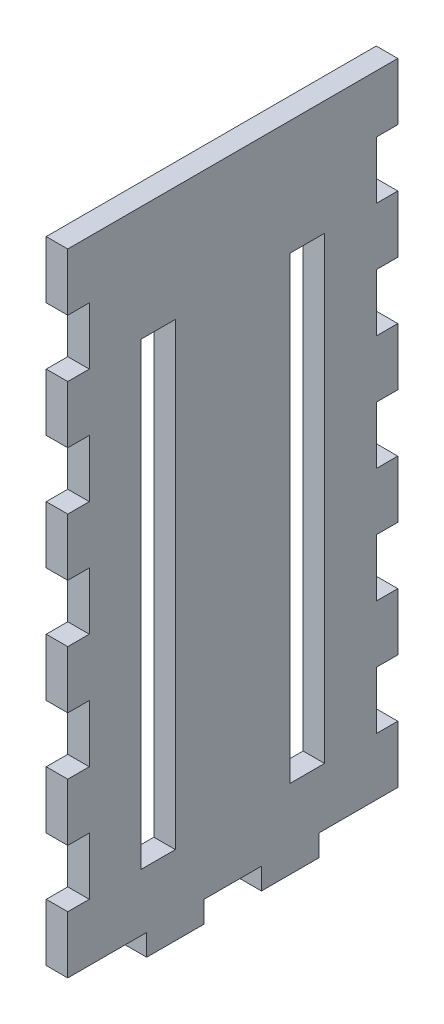
from build123d import *

# Parameters (mm, degrees)
SKETCH1_W               = 127
SKETCH1_H               = 279.4
BOSS_EXTRUDE1_DEPTH     = 9.525
SKETCH2_W               = 9.525
SKETCH2_H               = 25.4
BOSS_EXTRUDE2_DEPTH     = 9.525
LPATTERN1_COUNT         = 6
LPATTERN1_PITCH         = 50.8
MIRROR1_COPY_1_SKETCH_W = 9.525
MIRROR1_COPY_1_SKETCH_H = 25.4
MIRROR1_COPY_1_DEPTH    = 9.525
MIRROR1_COPY_2_SKETCH_W = 9.525
MIRROR1_COPY_2_SKETCH_H = 25.4
MIRROR1_COPY_2_DEPTH    = 9.525
MIRROR1_COPY_3_SKETCH_W = 9.525
MIRROR1_COPY_3_SKETCH_H = 25.4
MIRROR1_COPY_3_DEPTH    = 9.525
MIRROR1_COPY_4_SKETCH_W = 9.525
MIRROR1_COPY_4_SKETCH_H = 25.4
MIRROR1_COPY_4_DEPTH    = 9.525
MIRROR1_COPY_5_SKETCH_W = 9.525
MIRROR1_COPY_5_SKETCH_H = 25.4
MIRROR1_COPY_5_DEPTH    = 9.525
MIRROR1_COPY_6_SKETCH_W = 9.525
MIRROR1_COPY_6_SKETCH_H = 25.4
MIRROR1_COPY_6_DEPTH    = 9.525
SKETCH3_W               = 9.525
SKETCH3_H               = 25.4
BOSS_EXTRUDE3_DEPTH     = 9.525
LPATTERN2_COUNT         = 2
LPATTERN2_PITCH         = 50.8
SKETCH4_W               = 15.24
SKETCH4_H               = 203.2
CUT_EXTRUDE1_DEPTH      = 9.525


with BuildPart() as part:
    # Sketch1 → Boss-Extrude1 (new body)
    with BuildSketch(Plane(origin=(0, 0, 0), x_dir=(0, 0, -1), z_dir=(1, 0, 0))):
        Rectangle(SKETCH1_W, SKETCH1_H)
    extrude(amount=BOSS_EXTRUDE1_DEPTH)

    # Sketch2 → Boss-Extrude2 (add)
    with BuildSketch(Plane.XY.offset(63.5)):
        with Locations((4.7625, 127)):
            Rectangle(SKETCH2_W, SKETCH2_H)
    boss_extrude2 = extrude(amount=BOSS_EXTRUDE2_DEPTH)

    # LPattern1: Boss-Extrude2 ×6
    with Locations(*[(0, -i * LPATTERN1_PITCH, 0) for i in range(1, LPATTERN1_COUNT)]):
        add(boss_extrude2)

    # Mirror1 copy 1 sketch → Mirror1 copy 1 (add)
    with BuildSketch(Plane(origin=(0, -50.8, -63.5), x_dir=(1, 0, 0), z_dir=(0, 0, -1))):
        with Locations((4.7625, -127)):
            Rectangle(MIRROR1_COPY_1_SKETCH_W, MIRROR1_COPY_1_SKETCH_H)
    extrude(amount=MIRROR1_COPY_1_DEPTH)

    # Mirror1 copy 2 sketch → Mirror1 copy 2 (add)
    with BuildSketch(Plane(origin=(0, -101.6, -63.5), x_dir=(1, 0, 0), z_dir=(0, 0, -1))):
        with Locations((4.7625, -127)):
            Rectangle(MIRROR1_COPY_2_SKETCH_W, MIRROR1_COPY_2_SKETCH_H)
    extrude(amount=MIRROR1_COPY_2_DEPTH)

    # Mirror1 copy 3 sketch → Mirror1 copy 3 (add)
    with BuildSketch(Plane(origin=(0, -152.4, -63.5), x_dir=(1, 0, 0), z_dir=(0, 0, -1))):
        with Locations((4.7625, -127)):
            Rectangle(MIRROR1_COPY_3_SKETCH_W, MIRROR1_COPY_3_SKETCH_H)
    extrude(amount=MIRROR1_COPY_3_DEPTH)

    # Mirror1 copy 4 sketch → Mirror1 copy 4 (add)
    with BuildSketch(Plane(origin=(0, -203.2, -63.5), x_dir=(1, 0, 0), z_dir=(0, 0, -1))):
        with Locations((4.7625, -127)):
            Rectangle(MIRROR1_COPY_4_SKETCH_W, MIRROR1_COPY_4_SKETCH_H)
    extrude(amount=MIRROR1_COPY_4_DEPTH)

    # Mirror1 copy 5 sketch → Mirror1 copy 5 (add)
    with BuildSketch(Plane(origin=(0, -254, -63.5), x_dir=(1, 0, 0), z_dir=(0, 0, -1))):
        with Locations((4.7625, -127)):
            Rectangle(MIRROR1_COPY_5_SKETCH_W, MIRROR1_COPY_5_SKETCH_H)
    extrude(amount=MIRROR1_COPY_5_DEPTH)

    # Mirror1 copy 6 sketch → Mirror1 copy 6 (add)
    with BuildSketch(Plane(origin=(0, 0, -63.5), x_dir=(1, 0, 0), z_dir=(0, 0, -1))):
        with Locations((4.7625, -127)):
            Rectangle(MIRROR1_COPY_6_SKETCH_W, MIRROR1_COPY_6_SKETCH_H)
    extrude(amount=MIRROR1_COPY_6_DEPTH)

    # Sketch3 → Boss-Extrude3 (add)
    with BuildSketch(Plane.XZ.offset(139.7)):
        with Locations((4.7625, 25.4)):
            Rectangle(SKETCH3_W, SKETCH3_H)
    boss_extrude3 = extrude(amount=BOSS_EXTRUDE3_DEPTH)

    # LPattern2: Boss-Extrude3 ×2
    with Locations(*[(0, 0, -i * LPATTERN2_PITCH) for i in range(1, LPATTERN2_COUNT)]):
        add(boss_extrude3)

    # Sketch4 → Cut-Extrude1 (cut)
    with BuildSketch(Plane(origin=(9.525, 0, 0), x_dir=(0, 0, -1), z_dir=(1, 0, 0))):
        with Locations((-33.02, -12.7)):
            Rectangle(SKETCH4_W, SKETCH4_H)
    cut_extrude1 = extrude(amount=-CUT_EXTRUDE1_DEPTH, mode=Mode.SUBTRACT)

    # Mirror2: Cut-Extrude1 across plane
    add(cut_extrude1.mirror(Plane.XY), mode=Mode.SUBTRACT)


solid = part.part
